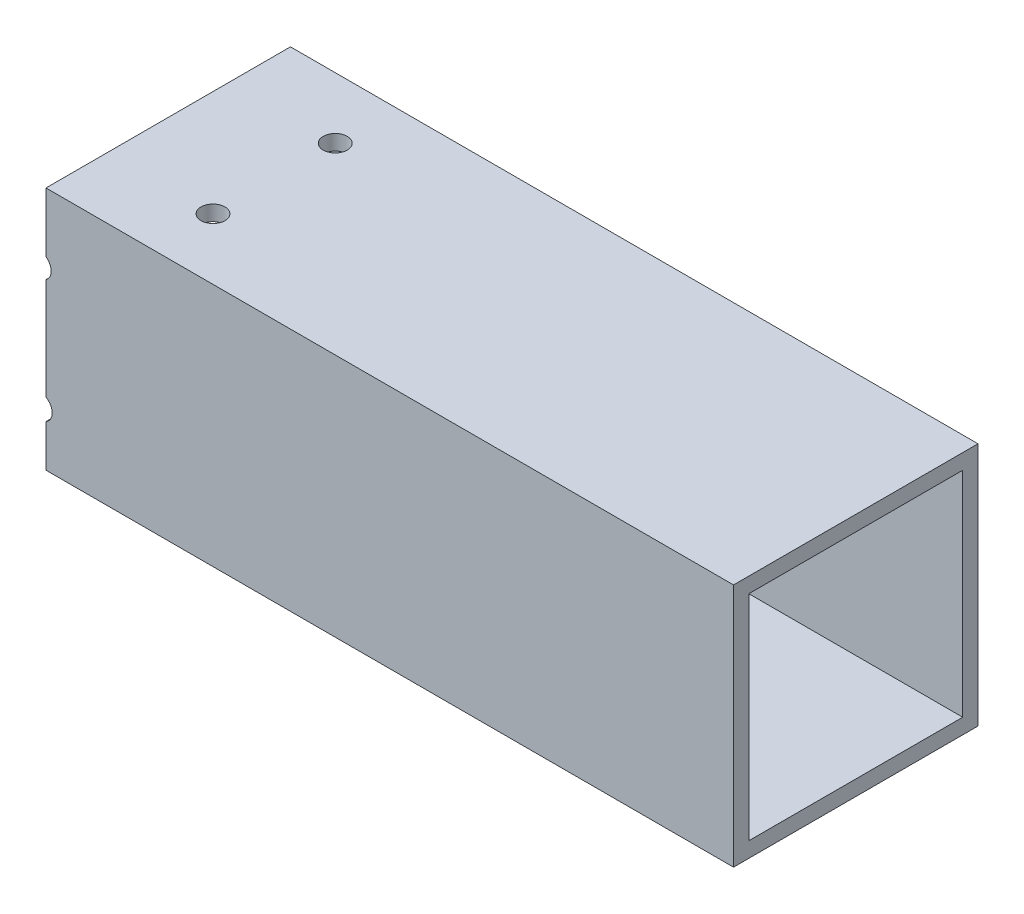
from build123d import *

# Parameters (mm, degrees)
SKETCH1_W           = 50.8
SKETCH1_H           = 50.8
BOSS_EXTRUDE1_DEPTH = 142.875
SHELL1_T            = -3.175
SKETCH2_R           = 2.4892
CUT_EXTRUDE1_DEPTH  = 160.920435295
SKETCH3_R           = 2.4892
CUT_EXTRUDE2_DEPTH  = 160.920435295
LPATTERN1_COUNT     = 6
LPATTERN1_PITCH     = 25.4


with BuildPart() as part:
    # Sketch1 → Boss-Extrude1 (new body)
    with BuildSketch(Plane(origin=(0, 0, 0), x_dir=(0, 0, -1), z_dir=(1, 0, 0))):
        with Locations((25.4, 25.4)):
            Rectangle(SKETCH1_W, SKETCH1_H)
    extrude(amount=BOSS_EXTRUDE1_DEPTH)

    # Shell1
    shell1_openings = [part.faces().sort_by_distance(p)[0] for p in [
        (0, 25.4, -25.4),
        (142.875, 25.4, -25.4),
    ]]
    offset(amount=SHELL1_T, openings=shell1_openings, kind=Kind.INTERSECTION)

    # Sketch2 → Cut-Extrude1 (cut, through all)
    with BuildSketch(Plane(origin=(0, 0, -50.8), x_dir=(-1, 0, 0), z_dir=(0, 0, -1))):
        with BuildLine():
            ThreePointArc((49.7199574, 36.05273466), (52.197249603, 33.657010691), (54.694002328, 36.032446614))
            ThreePointArc((54.694002328, 36.032446614), (52.216710126, 38.428170582), (49.7199574, 36.05273466))
        make_face()
        with BuildLine():
            ThreePointArc((54.378064353, 11.483170604), (52.468114384, 15.175420072), (49.828696677, 11.9638645))
            ThreePointArc((49.828696677, 11.9638645), (52.261760804, 13.222455177), (54.378064353, 11.483170604))
        make_face()
        with Locations((1.408247542, 36.353388684)):
            Circle(SKETCH2_R)
        with Locations((26.808247542, 36.353388684)):
            Circle(SKETCH2_R)
        with Locations((77.606557305, 35.938991288)):
            Circle(SKETCH2_R)
        with Locations((77.399358607, 10.539836406)):
            Circle(SKETCH2_R)
        with Locations((26.601048844, 10.954233802)):
            Circle(SKETCH2_R)
        with Locations((1.201048844, 10.954233802)):
            Circle(SKETCH2_R)
    extrude(amount=-CUT_EXTRUDE1_DEPTH, mode=Mode.SUBTRACT)

    # Sketch3 → Cut-Extrude2 (cut, through all)
    with BuildSketch(Plane.XZ):
        with Locations((21.99805708, -12.7)):
            Circle(SKETCH3_R)
        with Locations((21.99805708, -38.1)):
            Circle(SKETCH3_R)
    cut_extrude2 = extrude(amount=-CUT_EXTRUDE2_DEPTH, mode=Mode.SUBTRACT)

    # LPattern1: Cut-Extrude2 ×6
    with Locations(*[(-i * LPATTERN1_PITCH, 0, 0) for i in range(1, LPATTERN1_COUNT)]):
        add(cut_extrude2, mode=Mode.SUBTRACT)


solid = part.part
